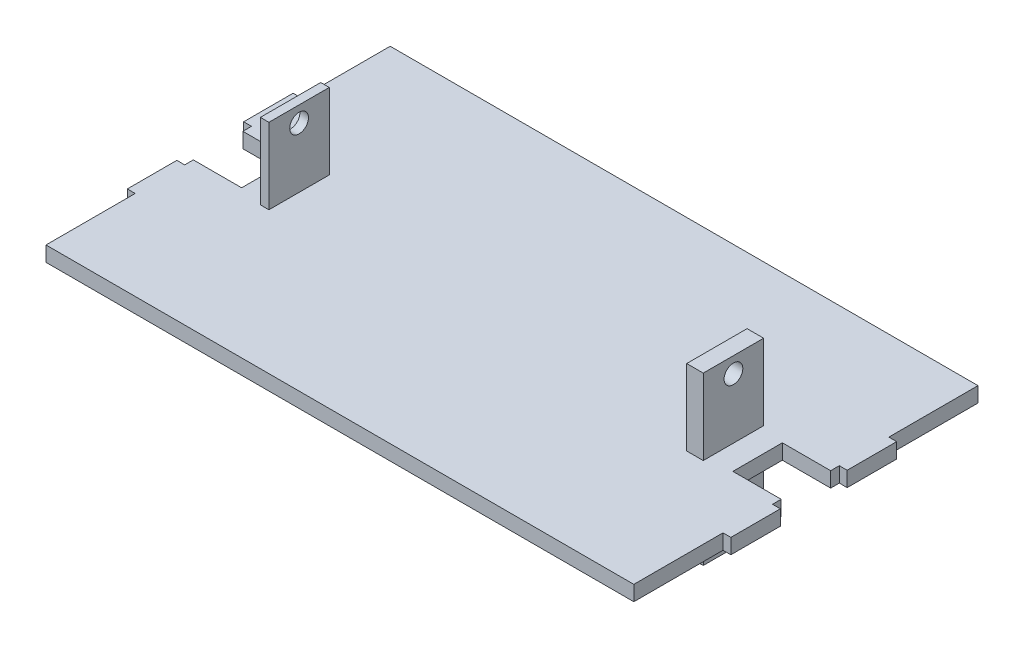
from build123d import *

# Parameters (mm, degrees)
BOSS_EXTRUDE1_DEPTH     = 3.175
SKETCH2_W               = 6.962265471
SKETCH2_H               = 25.4
SKETCH2_W_2             = 3.596765471
BOSS_EXTRUDE2_DEPTH     = 35.052
CUT_EXTRUDE1_DEPTH      = 235.326701605
CUT_EXTRUDE1_DEPTH_BACK = 235.326701605
SKETCH3_R               = 3.937


with BuildPart() as part:
    # Sketch1 → Boss-Extrude1 (new, symmetric)
    with BuildSketch(Plane(origin=(0, 0, 0), x_dir=(1, 0, 0), z_dir=(0, 1, 0))):
        Polygon((123.6345, -72.39), (-123.6345, -72.39), (-123.6345, -34.874677354), (-126.9365, -34.874677354), (-126.9365, -14.046677354), (-123.6345, -14.046677354), (-123.6345, -10.414), (-103.3145, -10.414), (-103.3145, 10.414), (-123.6345, 10.414), (-123.6345, 14.046677354), (-126.9365, 14.046677354), (-126.9365, 34.874677354), (-123.6345, 34.874677354), (-123.6345, 72.39), (123.6345, 72.39), (123.6345, 34.874677354), (126.9365, 34.874677354), (126.9365, 14.046677354), (123.6345, 14.046677354), (123.6345, 10.414), (103.3145, 10.414), (103.3145, -10.414), (123.6345, -10.414), (123.6345, -14.046677354), (126.9365, -14.046677354), (126.9365, -34.874677354), (123.6345, -34.874677354), align=None)
    extrude(amount=BOSS_EXTRUDE1_DEPTH, both=True)

    # Sketch2 → Boss-Extrude2 (add, symmetric)
    with BuildSketch(Plane(origin=(0, 0, 0), x_dir=(1, 0, 0), z_dir=(0, 1, 0))):
        with Locations((89.673367265, 0)):
            Rectangle(SKETCH2_W, SKETCH2_H)
        with Locations((-91.356117264, 0)):
            Rectangle(SKETCH2_W_2, SKETCH2_H)
    extrude(amount=BOSS_EXTRUDE2_DEPTH, both=True)

    # Sketch3 → Cut-Extrude1 (cut, two sides: drawn at the far end of the back side and taken through both)
    with BuildSketch(Plane.ZY.offset(93.1545).offset(-CUT_EXTRUDE1_DEPTH_BACK)):
        with Locations((0, 28.440626924)):
            Circle(SKETCH3_R)
        with Locations((0, -28.440626924)):
            Circle(SKETCH3_R)
    extrude(amount=CUT_EXTRUDE1_DEPTH + CUT_EXTRUDE1_DEPTH_BACK, mode=Mode.SUBTRACT)


solid = part.part
